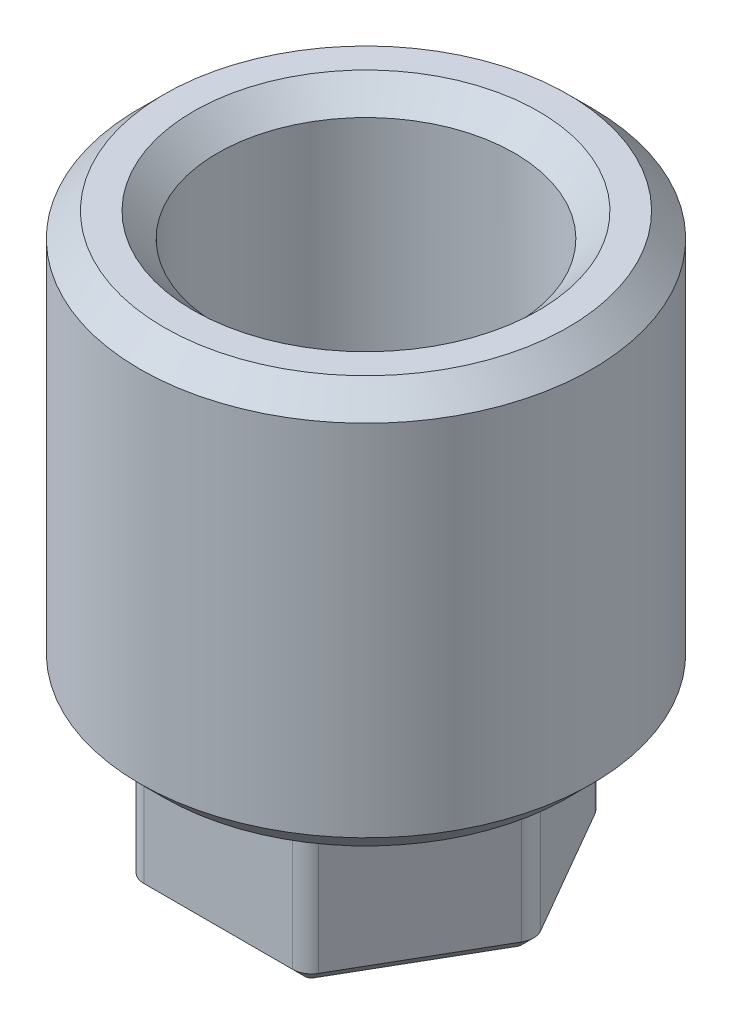
from build123d import *

# Parameters (mm, degrees)
BOSS_EXTRUDE1_DEPTH = 3.175
SKETCH2_R           = 4.7625
BOSS_EXTRUDE2_DEPTH = 2.23012
SKETCH3_R           = 4.7625
SKETCH3_R_2         = 3.126994
BOSS_EXTRUDE3_DEPTH = 6.35
BOSS_EXTRUDE4_DEPTH = 1.5
FILLET1_1_64_R      = 0.396875
CHAMFER1_0_02_SIZE  = 0.508
CHAMFER2_0_005_SIZE = 0.127
CHAMFER3_0_01_SIZE  = 0.254


with BuildPart() as part:
    # Sketch1 → Boss-Extrude1 (new body)
    with BuildSketch(Plane(origin=(0, 0, 0), x_dir=(1, 0, 0), z_dir=(0, 1, 0))):
        Polygon((1.796425363, 3.1115), (-1.796425363, 3.1115), (-3.592850725, 0), (-1.796425363, -3.1115), (1.796425363, -3.1115), (3.592850725, 0), align=None)
    extrude(amount=BOSS_EXTRUDE1_DEPTH)

    # Sketch2 → Boss-Extrude2 (add)
    with BuildSketch(Plane(origin=(0, 3.175, 0), x_dir=(1, 0, 0), z_dir=(0, 1, 0))):
        with Locations(Location((0, 0, 0), (0, 0, 270))):
            Circle(SKETCH2_R)
    extrude(amount=BOSS_EXTRUDE2_DEPTH)

    # Sketch3 → Boss-Extrude3 (add)
    with BuildSketch(Plane(origin=(0, 5.40512, 0), x_dir=(1, 0, 0), z_dir=(0, 1, 0))):
        with Locations(Location((0, 0, 0), (0, 0, 270))):
            Circle(SKETCH3_R)
        with Locations(Location((0, 0, 0), (0, 0, 270))):
            Circle(SKETCH3_R_2, mode=Mode.SUBTRACT)
    extrude(amount=BOSS_EXTRUDE3_DEPTH)

    # Sketch4 → Boss-Extrude4 (add)
    with BuildSketch(Plane(origin=(0, 5.40512, 0), x_dir=(1, 0, 0), z_dir=(0, 1, 0))):
        with BuildLine():
            Line((-3.094445261, 0.45), (3.094445261, 0.45))
            ThreePointArc((3.094445261, 0.45), (3.126994, 0), (3.094445261, -0.45))
            Line((3.094445261, -0.45), (-3.094445261, -0.45))
            ThreePointArc((-3.094445261, -0.45), (-3.126994, 0), (-3.094445261, 0.45))
        make_face()
    extrude(amount=BOSS_EXTRUDE4_DEPTH)

    # Fillet1-1/64
    fillet1_1_64_edges = [part.edges().sort_by_distance(p)[0] for p in [
        (-2.694638044, 3.175, -1.55575),
        (3.592850725, 1.5875, 0),
        (1.796425363, 1.5875, 3.1115),
        (-1.796425363, 1.5875, 3.1115),
        (-3.592850725, 1.5875, 0),
        (-1.796425363, 1.5875, -3.1115),
        (1.796425363, 1.5875, -3.1115),
        (-2.694638044, 3.175, 1.55575),
        (0, 3.175, 3.1115),
        (2.694638044, 3.175, 1.55575),
        (0, 5.40512, -3.126994),
        (-2.045842635, 5.40512, 2.36487196),
        (-3.094445261, 6.15512, -0.45),
        (0, 5.40512, 0.45),
        (-3.094445261, 6.15512, 0.45),
        (3.094445261, 6.15512, 0.45),
        (0, 5.40512, -0.45),
        (3.094445261, 6.15512, -0.45),
        (2.694638044, 3.175, -1.55575),
        (0, 3.175, -3.1115),
    ]]
    fillet(fillet1_1_64_edges, radius=FILLET1_1_64_R)

    # Chamfer1-0.02
    chamfer1_0_02_edges = [part.edges().sort_by_distance(p)[0] for p in [
        (0, 3.175, -4.7625),
        (0, 11.75512, -4.7625),
        (0, 11.75512, -3.126994),
    ]]
    chamfer(chamfer1_0_02_edges, length=CHAMFER1_0_02_SIZE)

    # Chamfer2-0.005
    # the kernel refuses this chamfer: 0.127 mm, written as the material it takes off along each edge
    with BuildSketch(Plane(origin=(-2.595448418, 6.90512, -0.45), x_dir=(0, 0.027495876610587285, 0.9996219169112968), z_dir=(1, 0, 0)), Plane(origin=(2.595448418, 6.90512, 0.45), x_dir=(0, 0.027495876610587285, -0.9996219169112968), z_dir=(-1, 0, 0))) as chamfer2_0_005_piece_1:
        Polygon((CHAMFER2_0_005_SIZE * 0.999621916911, CHAMFER2_0_005_SIZE * 0.0274958766106), (-CHAMFER2_0_005_SIZE * 0.0274958766106, CHAMFER2_0_005_SIZE * 0.999621916911), (0, 0), align=None)
    extrude(amount=5.190896835, mode=Mode.SUBTRACT)
    with BuildSketch(Plane(origin=(-2.595448418, 6.90512, -0.846875), x_dir=(-0.4186703663111546, 0, -0.9081382738178606), z_dir=(0.9081382738178606, 0, -0.4186703663111546))) as chamfer2_0_005_piece_2_section:
        Polygon((0.396875 + CHAMFER2_0_005_SIZE, 0), (0.396875, -CHAMFER2_0_005_SIZE), (0.396875, 0), align=None)
    chamfer2_0_005_piece_2 = revolve(axis=Axis((-2.595448418, 6.90512, -0.846875), (0, 1, 0)), revolution_arc=155.249329417, mode=Mode.PRIVATE)
    chamfer2_0_005_piece_2 = chamfer2_0_005_piece_2 & Plane(origin=(0, 6.859082355, 0), x_dir=(0, 0, 1), z_dir=(0, -1, 0)) * Cylinder(3.126994, 3, mode=Mode.PRIVATE)
    add(chamfer2_0_005_piece_2, mode=Mode.SUBTRACT)
    with BuildSketch(Plane(origin=(-2.595448418, 6.90512, 0.846875), x_dir=(-0.41867036631116117, 0, 0.9081382738178575), z_dir=(0.9081382738178575, 0, 0.41867036631116117))) as chamfer2_0_005_piece_3_section:
        Polygon((0.396875, CHAMFER2_0_005_SIZE), (0.396875 + CHAMFER2_0_005_SIZE, 0), (0.396875, 0), align=None)
    chamfer2_0_005_piece_3 = revolve(axis=Axis((-2.595448418, 6.90512, 0.846875), (0, -1, 0)), revolution_arc=155.249329417, mode=Mode.PRIVATE)
    chamfer2_0_005_piece_3 = chamfer2_0_005_piece_3 & Plane(origin=(0, 6.859082356, 0), x_dir=(0, 0, 1), z_dir=(0, -1, 0)) * Cylinder(3.126994, 3, mode=Mode.PRIVATE)
    add(chamfer2_0_005_piece_3, mode=Mode.SUBTRACT)
    with BuildSketch(Plane(origin=(2.595448418, 6.90512, -0.846875), x_dir=(0.41867036631115895, 0, -0.9081382738178586), z_dir=(-0.9081382738178586, 0, -0.41867036631115895))) as chamfer2_0_005_piece_4_section:
        Polygon((0.396875 + CHAMFER2_0_005_SIZE, 0), (0.396875, CHAMFER2_0_005_SIZE), (0.396875, 0), align=None)
    chamfer2_0_005_piece_4 = revolve(axis=Axis((2.595448418, 6.90512, -0.846875), (0, -1, 0)), revolution_arc=155.249329417, mode=Mode.PRIVATE)
    chamfer2_0_005_piece_4 = chamfer2_0_005_piece_4 & Plane(origin=(0, 6.859082492, 0), x_dir=(0, 0, 1), z_dir=(0, -1, 0)) * Cylinder(3.126994, 3, mode=Mode.PRIVATE)
    add(chamfer2_0_005_piece_4, mode=Mode.SUBTRACT)
    with BuildSketch(Plane(origin=(2.595448418, 6.90512, 0.846875), x_dir=(0.41867036631115895, 0, 0.9081382738178586), z_dir=(-0.9081382738178586, 0, 0.41867036631115895))) as chamfer2_0_005_piece_5_section:
        Polygon((0.396875 + CHAMFER2_0_005_SIZE, 0), (0.396875, -CHAMFER2_0_005_SIZE), (0.396875, 0), align=None)
    chamfer2_0_005_piece_5 = revolve(axis=Axis((2.595448418, 6.90512, 0.846875), (0, 1, 0)), revolution_arc=155.249329417, mode=Mode.PRIVATE)
    chamfer2_0_005_piece_5 = chamfer2_0_005_piece_5 & Plane(origin=(0, 6.859082356, 0), x_dir=(0, 0, 1), z_dir=(0, -1, 0)) * Cylinder(3.126994, 3, mode=Mode.PRIVATE)
    add(chamfer2_0_005_piece_5, mode=Mode.SUBTRACT)

    # Chamfer3-0.01
    chamfer3_0_01_edges = [part.edges().sort_by_distance(p)[0] for p in [
        (2.694638044, 0, 1.55575),
        (2.694638044, 0, -1.55575),
        (0, 0, 3.1115),
        (-2.694638044, 0, 1.55575),
        (-2.694638044, 0, -1.55575),
        (0, 0, -3.1115),
        (1.765726974, 0, -3.058328832),
        (3.531453949, 0, 0),
        (-1.765726974, 0, -3.058328832),
        (-3.531453949, 0, 0),
        (-1.765726974, 0, 3.058328832),
        (1.765726974, 0, 3.058328832),
    ]]
    chamfer(chamfer3_0_01_edges, length=CHAMFER3_0_01_SIZE)


solid = part.part
